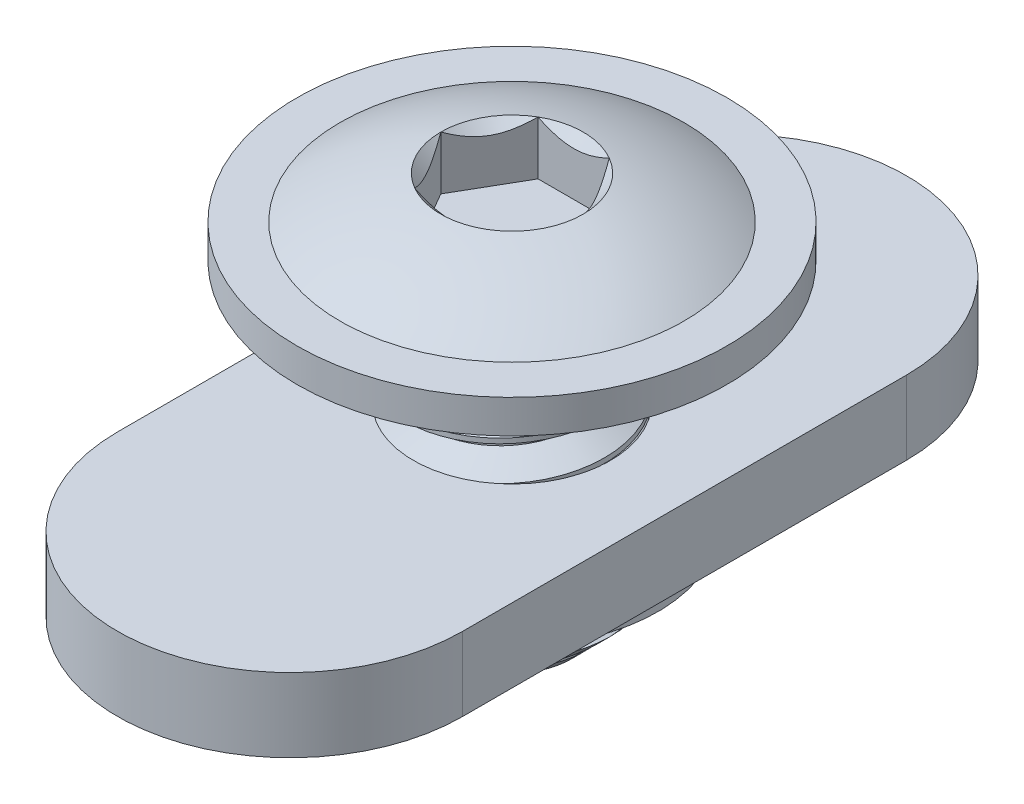
from build123d import *

# Parameters (mm, degrees)
SKETCH2_W                    = 3.175
SKETCH2_H                    = 10.16
CHAMFER1_SIZE                = 1.27
CUT_SWEEP1_PITCH             = 1.27
CUT_EXTRUDE1_DEPTH           = 1.984375
SKETCH7_R                    = 2.291358881
CUT_EXTRUDE2_DEPTH           = 1.726209
CUT_EXTRUDE2_TAPER           = 45
CUT_EXTRUDE2_OTHER_WAY_DEPTH = 16.950832279
SKETCH8_R                    = 3.175
EXTRUDE1_DEPTH               = 1.7272
SKETCH9_R                    = 4.699
CUT_EXTRUDE3_DEPTH           = 1.0795


with BuildPart() as part:
    # Sketch2 → Revolve2 (revolve)
    with BuildSketch(Plane.XY, mode=Mode.PRIVATE) as revolve2_sk:
        with Locations((-1.5875, 0)):
            Rectangle(SKETCH2_W, SKETCH2_H)
    revolve(revolve2_sk.sketch.rotate(Axis((0, 0, 0), (0, 1, 0)), 270), axis=Axis((0, 0, 0), (0, 1, 0)))

    # Chamfer1
    chamfer1_edges = [part.edges().sort_by_distance(p)[0] for p in [
        (0, -5.08, 3.175),
    ]]
    chamfer(chamfer1_edges, length=CHAMFER1_SIZE)

    # Cut-Sweep1: the profile of Sketch4 profile screwed along a right-hand helix of 11.75 turns, 6 arcs to a turn; built about Z, then put on its axis
    cut_sweep1_z = Axis((0, 0, 0), (0, 0, 1))
    cut_sweep1_corners = [(3.1753, 0, -1.111423205), (3.1753, 0, 0.000173205), (2.350110803, 0, -0.47625), (2.350110803, 0, -0.635)]
    with BuildLine(mode=Mode.PRIVATE) as cut_sweep1_profile:
        Line(cut_sweep1_corners[0], cut_sweep1_corners[1])
        Line(cut_sweep1_corners[1], cut_sweep1_corners[2])
        Line(cut_sweep1_corners[2], cut_sweep1_corners[3])
        Line(cut_sweep1_corners[3], cut_sweep1_corners[0])
    cut_sweep1_cap = Face(cut_sweep1_profile.wire())
    cut_sweep1_turn_angles = [0, 30, 60, 90, 120, 150, 180, 210, 240, 270, 300, 330, 360]
    cut_sweep1_turn_weights = [1, 0.8660254037844387, 1, 0.8660254037844387, 1, 0.8660254037844387, 1, 0.8660254037844387, 1, 0.8660254037844387, 1, 0.8660254037844387, 1]
    cut_sweep1_turn_rails = [Edge.make_bspline([Vector(p[0], p[1], 0).rotate(cut_sweep1_z, cut_sweep1_turn_angles[k]) / cut_sweep1_turn_weights[k] + Vector(0, 0, p[2] + CUT_SWEEP1_PITCH * cut_sweep1_turn_angles[k] / 360) for k in range(13)], [0, 0, 0, 1, 1, 2, 2, 3, 3, 4, 4, 5, 5, 6, 6, 6], 2, cut_sweep1_turn_weights) for p in cut_sweep1_corners]
    cut_sweep1_turn_sides = [Face.make_surface_from_curves(cut_sweep1_turn_rails[p[0]], cut_sweep1_turn_rails[p[1]]) for p in [(0, 1), (1, 2), (2, 3), (3, 0)]]
    cut_sweep1_last_angles = [3960, 3990, 4020, 4050, 4080, 4110, 4140, 4170, 4200, 4215, 4230]
    cut_sweep1_last_weights = [1, 0.8660254037844387, 1, 0.8660254037844387, 1, 0.8660254037844387, 1, 0.8660254037844387, 1, 0.9659258262890169, 1]
    cut_sweep1_last_rails = [Edge.make_bspline([Vector(p[0], p[1], 0).rotate(cut_sweep1_z, cut_sweep1_last_angles[k]) / cut_sweep1_last_weights[k] + Vector(0, 0, p[2] + CUT_SWEEP1_PITCH * cut_sweep1_last_angles[k] / 360) for k in range(11)], [0, 0, 0, 1, 1, 2, 2, 3, 3, 4, 4, 5, 5, 5], 2, cut_sweep1_last_weights) for p in cut_sweep1_corners]
    cut_sweep1_last_sides = [Face.make_surface_from_curves(cut_sweep1_last_rails[p[0]], cut_sweep1_last_rails[p[1]]) for p in [(0, 1), (1, 2), (2, 3), (3, 0)]]
    cut_sweep1 = Plane(origin=(0, 5.08, 0), x_dir=(1, 0, 0), z_dir=(0, -1, 0)) * Solid(Shell([*[p.moved(Location((0, 0, CUT_SWEEP1_PITCH * i))) for i in range(11) for p in cut_sweep1_turn_sides], *cut_sweep1_last_sides, cut_sweep1_cap, cut_sweep1_cap.rotate(cut_sweep1_z, 4230).moved(Location((0, 0, CUT_SWEEP1_PITCH * 4230 / 360)))]))
    add(cut_sweep1, mode=Mode.SUBTRACT)

    # Sketch5 → Revolve3 (revolve)
    with BuildSketch(Plane.XY):
        with BuildLine():
            Line((0, 5.08), (0, 7.7724))
            ThreePointArc((0, 7.7724), (-2.884017607, 7.360293811), (-5.5372, 6.15696))
            Line((-5.5372, 6.15696), (-6.9215, 6.15696))
            Line((-6.9215, 6.15696), (-6.9215, 5.08))
            Line((-6.9215, 5.08), (0, 5.08))
        make_face()
    revolve(axis=Axis((0, 0, 0), (0, 1, 0)))

    # Sketch6 → Cut-Extrude1 (cut)
    with BuildSketch(Plane(origin=(0, 7.7724, 0), x_dir=(-1, 0, 0), z_dir=(0, 1, 0))):
        Polygon((1.14567944, 1.984375), (-1.14567944, 1.984375), (-2.291358881, 0), (-1.14567944, -1.984375), (1.14567944, -1.984375), (2.291358881, 0), align=None)
    extrude(amount=-CUT_EXTRUDE1_DEPTH, mode=Mode.SUBTRACT)

    # Sketch7 → Cut-Extrude2 (cut)
    with BuildSketch(Plane(origin=(0, 7.514233625, 0), x_dir=(-1, 0, 0), z_dir=(0, 1, 0))):
        Circle(SKETCH7_R)
    extrude(amount=-CUT_EXTRUDE2_DEPTH, taper=CUT_EXTRUDE2_TAPER, mode=Mode.SUBTRACT)

    # Sketch7 → Cut-Extrude2 other way (cut)
    with BuildSketch(Plane(origin=(0, 7.514233625, 0), x_dir=(-1, 0, 0), z_dir=(0, 1, 0))):
        Circle(SKETCH7_R)
    extrude(amount=CUT_EXTRUDE2_OTHER_WAY_DEPTH, mode=Mode.SUBTRACT)


with BuildPart() as body_2:
    # Sketch8 → Extrude1 (new, symmetric)
    with BuildSketch(Plane.XZ.offset(0.635)):
        with BuildLine():
            Line((-5.55625, 7.14375), (-5.55625, -7.14375))
            ThreePointArc((-5.55625, -7.14375), (0, -12.7), (5.55625, -7.14375))
            Line((5.55625, -7.14375), (5.55625, 7.14375))
            ThreePointArc((5.55625, 7.14375), (0, 12.7), (-5.55625, 7.14375))
        make_face()
        with Locations(Location((0, 0, 0), (0, 0, 270))):
            Circle(SKETCH8_R, mode=Mode.SUBTRACT)
    extrude(amount=EXTRUDE1_DEPTH, both=True)

    # Sketch9 → Cut-Extrude3 (cut)
    with BuildSketch(Plane.XZ.offset(2.3622)):
        with BuildLine():
            Line((5.55625, -7.14375), (5.55625, 7.14375))
            ThreePointArc((5.55625, 7.14375), (0, 12.7), (-5.55625, 7.14375))
            Line((-5.55625, 7.14375), (-5.55625, -7.14375))
            ThreePointArc((-5.55625, -7.14375), (0, -12.7), (5.55625, -7.14375))
        make_face()
        with Locations(Location((0, 0, 0), (0, 0, 270))):
            Circle(SKETCH9_R, mode=Mode.SUBTRACT)
    extrude(amount=-CUT_EXTRUDE3_DEPTH, mode=Mode.SUBTRACT)


solid = Compound([part.part, body_2.part])
